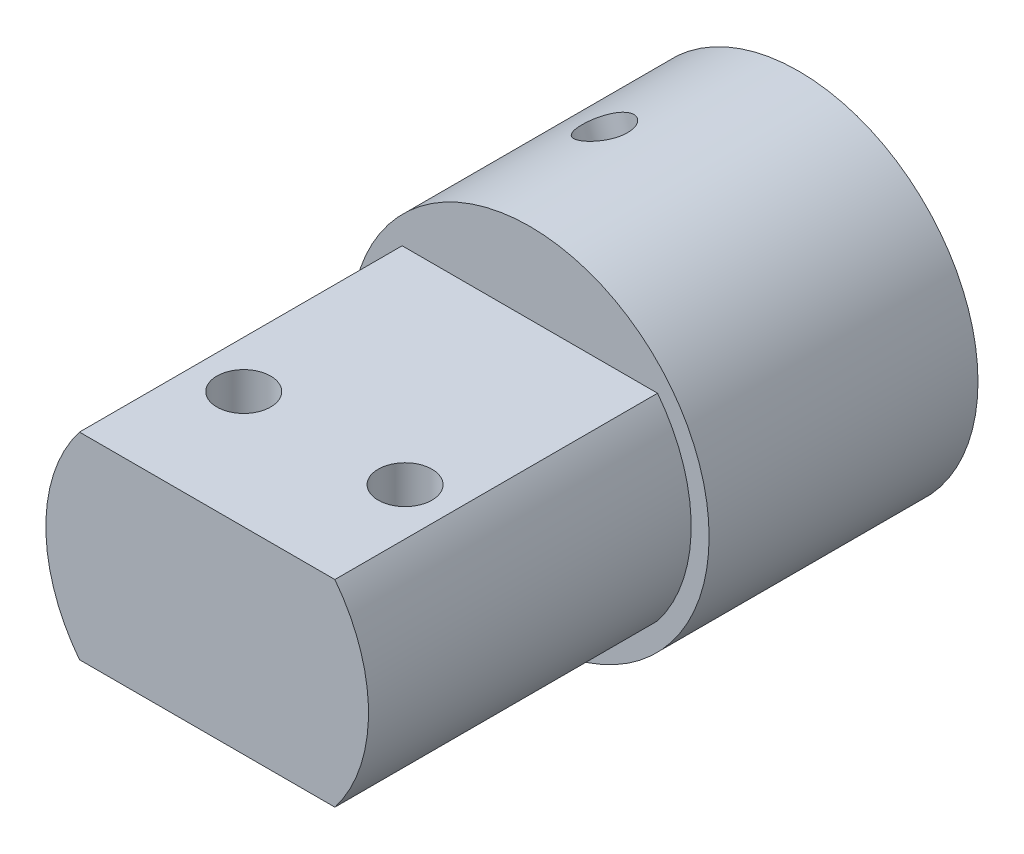
from build123d import *

# Parameters (mm, degrees)
SKETCH_1_R          = 5.25
EXTRUDE_1_DEPTH     = 15
CUT_EXTRUDE_START   = -10
CUT_EXTRUDE_1_DEPTH = 10
EXTRUDE_2_DEPTH     = 18
SKETCH_4_R          = 1.5
CUT_EXTRUDE_2_DEPTH = 39.304699451
SKETCH_5_R          = 14
SKETCH_5_R_2        = 5.25
EXTRUDE_3_DEPTH     = 15
SKETCH_6_R          = 18.043638251
SKETCH_6_R_2        = 10
CUT_EXTRUDE_3_DEPTH = 15
SKETCH_7_R          = 6.986522344
EXTRUDE_4_DEPTH     = 15
SKETCH_8_R          = 1.35
CUT_EXTRUDE_4_DEPTH = 15


with BuildPart() as part:
    # 草图1 → 凸台-拉伸1 (new body)
    with BuildSketch(Plane.XY):
        with BuildLine():
            Line((-11.489125293, -8), (11.489125293, -8))
            ThreePointArc((11.489125293, -8), (0, 14), (-11.489125293, -8))
        make_face()
        Circle(SKETCH_1_R, mode=Mode.SUBTRACT)
    extrude(amount=EXTRUDE_1_DEPTH)

    # 草图2 → 切除-拉伸1 (cut)
    with BuildSketch(Plane.XY.offset(15).offset(CUT_EXTRUDE_START)):
        with BuildLine():
            Line((-13.416407865, 4), (13.416407865, 4))
            ThreePointArc((13.416407865, 4), (0, 14), (-13.416407865, 4))
        make_face()
    extrude(amount=CUT_EXTRUDE_1_DEPTH, mode=Mode.SUBTRACT)

    # 草图3 → 凸台-拉伸2 (add)
    with BuildSketch(Plane.XY.offset(15)):
        with BuildLine():
            Line((-7.123903424, 5.5), (7.123903424, 5.5))
            ThreePointArc((7.123903424, 5.5), (9, 0), (7.123903424, -5.5))
            Line((7.123903424, -5.5), (-7.123903424, -5.5))
            ThreePointArc((-7.123903424, -5.5), (-9, 0), (-7.123903424, 5.5))
        make_face()
    extrude(amount=EXTRUDE_2_DEPTH)

    # 草图4 → 切除-拉伸2 (cut, through all)
    with BuildSketch(Plane(origin=(0, 5.5, 0), x_dir=(1, 0, 0), z_dir=(0, 1, 0))):
        with Locations((4.5, -26.46)):
            Circle(SKETCH_4_R)
        with Locations((-4.5, -26.46)):
            Circle(SKETCH_4_R)
    extrude(amount=-CUT_EXTRUDE_2_DEPTH, mode=Mode.SUBTRACT)

    # 草图5 → 凸台-拉伸3 (add)
    with BuildSketch(Plane(origin=(0, 0, 0), x_dir=(-1, 0, 0), z_dir=(0, 0, -1))):
        Circle(SKETCH_5_R)
        Circle(SKETCH_5_R_2, mode=Mode.SUBTRACT)
    extrude(amount=-EXTRUDE_3_DEPTH)

    # 草图6 → 切除-拉伸3 (cut)
    with BuildSketch(Plane(origin=(0, 0, 0), x_dir=(-1, 0, 0), z_dir=(0, 0, -1))):
        Circle(SKETCH_6_R)
        Circle(SKETCH_6_R_2, mode=Mode.SUBTRACT)
    extrude(amount=-CUT_EXTRUDE_3_DEPTH, mode=Mode.SUBTRACT)

    # 草图7 → 凸台-拉伸4 (add)
    with BuildSketch(Plane(origin=(0, 0, 0), x_dir=(-1, 0, 0), z_dir=(0, 0, -1))):
        Circle(SKETCH_7_R)
        with BuildLine():
            Line((-1.508384725, 4.76705103), (4.154021266, 2.782823624))
            ThreePointArc((4.154021266, 2.782823624), (-1.653522838, -4.718671659), (-1.508384725, 4.76705103))
        make_face(mode=Mode.SUBTRACT)
    extrude(amount=-EXTRUDE_4_DEPTH)

    # 草图8 → 切除-拉伸4 (cut)
    with BuildSketch(Plane(origin=(-1.32281827, 3.774937327, 0), x_dir=(0.9437343317723381, 0.3307045676041059, 0), z_dir=(0.3307045676041059, -0.9437343317723381, 0))):
        with Locations((0, 7.544256547)):
            Circle(SKETCH_8_R)
    extrude(amount=-CUT_EXTRUDE_4_DEPTH, mode=Mode.SUBTRACT)


solid = part.part
